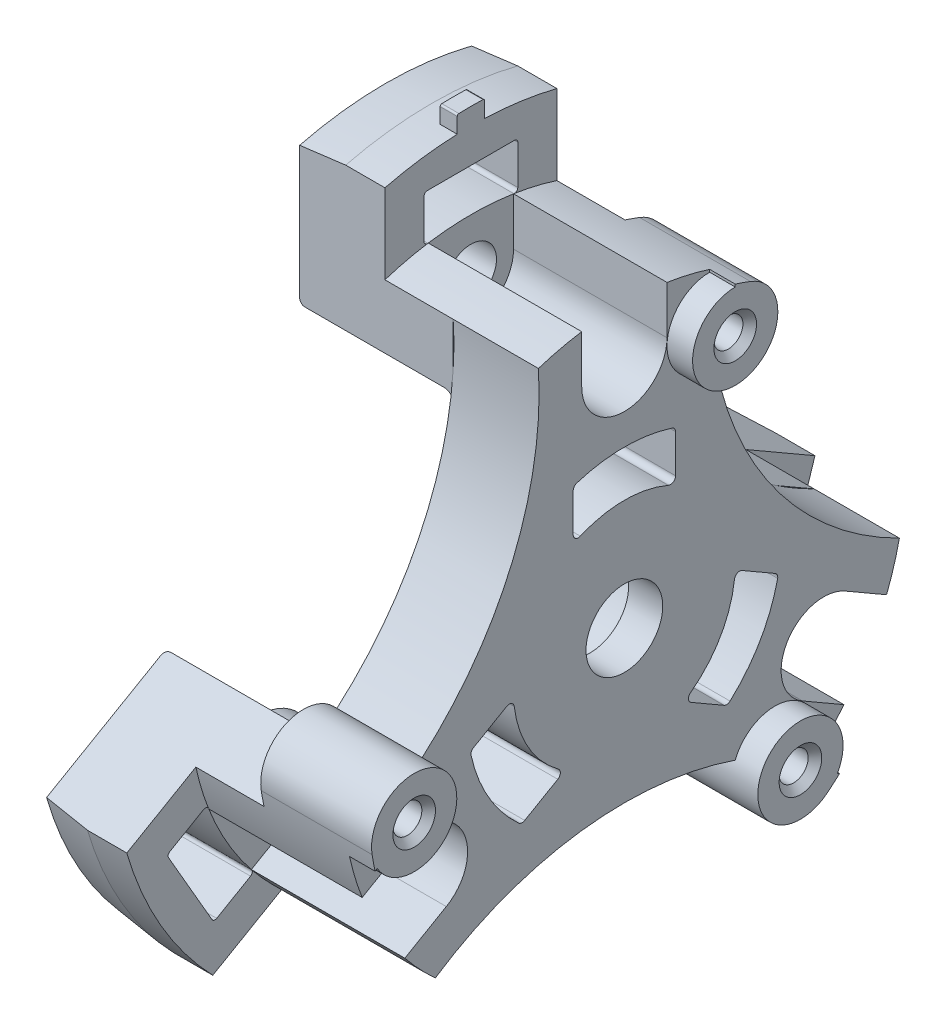
from build123d import *
from build123d.topology import SkipClean

# Parameters (mm, degrees)
SKETCH_2_R                           = 20
CUT_EXTRUDE_1_DEPTH                  = 10
PATTERN_CIRCULAR_1_COUNT             = 3
CUT_EXTRUDE_START                    = -10
CUT_EXTRUDE_2_DEPTH                  = 10
PATTERN_CIRCULAR_2_COUNT             = 3
SKETCH_4_R                           = 1.5
EXTRUDE_1_DEPTH                      = 9
PATTERN_CIRCULAR_3_COUNT             = 3
CUT_EXTRUDE_START_2                  = -1.7
CUT_EXTRUDE_3_DEPTH                  = 1.7
CUT_EXTRUDE_START_3                  = -2.5
CUT_EXTRUDE_8_DEPTH                  = 2.5
PATTERN_CIRCULAR_4_COUNT             = 3
CUT_EXTRUDE_4_DEPTH                  = 9
PATTERN_CIRCULAR_5_COUNT             = 3
EXTRUDE_START                        = -6.5
EXTRUDE_2_DEPTH                      = 6.5
SKETCH_9_R                           = 0.85
CUT_EXTRUDE_7_DEPTH                  = 6.4
CHAMFER_3_SIZE                       = 0.4
PATTERN_CIRCULAR_8_COUNT             = 3
CHAMFER_3_OF_PATTERN_CIRCULAR_8_SIZE = 0.4
CHAMFER_4_SIZE                       = 0.35
CHAMFER_4_SIZE2                      = 0.606217783
FILLET_6_R                           = 0.5
FILLET_7_R                           = 0.5
EXTRUDE_START_2                      = -5
EXTRUDE_3_DEPTH                      = 5
PATTERN_CIRCULAR_9_COUNT             = 3
EXTRUDE_4_DEPTH                      = 1
FILLET_9_R                           = 0.3
FILLET_10_R                          = 0.2
FILLET_11_R                          = 0.2


with BuildPart() as part:
    # 草图1 → 旋转1 (revolve)
    with BuildSketch(Plane.XY, mode=Mode.PRIVATE) as revolve_1_sk:
        Polygon((-7, 6.5), (-5, 6.5), (-5, 16.5), (0, 16.5), (0, 2.25), (-2, 2.25), (-2, 4), (-7, 4), align=None)
    revolve(revolve_1_sk.sketch.rotate(Axis((-65.742857143, 0, 0), (1, 0, 0)), 90), axis=Axis((-65.742857143, 0, 0), (1, 0, 0)))

    # 草图2 → 切除-拉伸1 (cut)
    with BuildSketch(Plane.ZY.offset(5)):
        with Locations((-25, 14.43375673)):
            Circle(SKETCH_2_R)
    cut_extrude_1 = extrude(amount=-CUT_EXTRUDE_1_DEPTH, mode=Mode.SUBTRACT)

    # 阵列(圆周)1: 切除-拉伸1 ×3 about axis
    pattern_circular_1_axis = Axis((0, 0, 0), (1, 0, 0))
    for i in range(1, PATTERN_CIRCULAR_1_COUNT):
        add(cut_extrude_1.rotate(pattern_circular_1_axis, i * 360 / PATTERN_CIRCULAR_1_COUNT), mode=Mode.SUBTRACT)

    # 草图3 → 切除-拉伸2 (cut)
    with BuildSketch(Plane.ZY.offset(5).offset(CUT_EXTRUDE_START)):
        with BuildLine():
            Line((-3, 8.480566019), (-3, 6.240993511))
            ThreePointArc((-3, 6.240993511), (-2.864719012, 5.990259295), (-2.580882353, 5.965655562))
            ThreePointArc((-2.580882353, 5.965655562), (0, 6.5), (2.580882353, 5.965655562))
            ThreePointArc((2.580882353, 5.965655562), (2.864719012, 5.990259295), (3, 6.240993511))
            Line((3, 6.240993511), (3, 8.480566019))
            ThreePointArc((3, 8.480566019), (2.9421811, 8.657620571), (2.791011236, 8.766427795))
            ThreePointArc((2.791011236, 8.766427795), (0, 9.2), (-2.791011236, 8.766427795))
            ThreePointArc((-2.791011236, 8.766427795), (-2.9421811, 8.657620571), (-3, 8.480566019))
        make_face()
    cut_extrude_2 = extrude(amount=CUT_EXTRUDE_2_DEPTH, mode=Mode.SUBTRACT)

    # 阵列(圆周)2: 切除-拉伸2 ×3 about axis
    pattern_circular_2_axis = Axis((0, 0, 0), (1, 0, 0))
    for i in range(1, PATTERN_CIRCULAR_2_COUNT):
        add(cut_extrude_2.rotate(pattern_circular_2_axis, i * 360 / PATTERN_CIRCULAR_2_COUNT), mode=Mode.SUBTRACT)

    # 草图4 → 凸台-拉伸1 (add)
    with BuildSketch(Plane.ZY.offset(5)):
        with BuildLine():
            Line((-5.040834524, 15.711142139), (-5.040834524, 11.98290396))
            ThreePointArc((-5.040834524, 11.98290396), (-4.096768005, 12.337604788), (-3.128046355, 12.618055556))
            ThreePointArc((-3.128046355, 12.618055556), (0, 10.25), (3.128046355, 12.618055556))
            ThreePointArc((3.128046355, 12.618055556), (4.096768005, 12.337604788), (5.040834524, 11.98290396))
            Line((5.040834524, 11.98290396), (5.040834524, 15.711142139))
            ThreePointArc((5.040834524, 15.711142139), (0, 16.5), (-5.040834524, 15.711142139))
        make_face()
        with Locations((0, 13.5)):
            Circle(SKETCH_4_R, mode=Mode.SUBTRACT)
    extrude_1 = extrude(amount=EXTRUDE_1_DEPTH)

    # 阵列(圆周)3: 凸台-拉伸1 ×3 about axis
    pattern_circular_3_axis = Axis((0, 0, 0), (1, 0, 0))
    for i in range(1, PATTERN_CIRCULAR_3_COUNT):
        add(extrude_1.rotate(pattern_circular_3_axis, i * 360 / PATTERN_CIRCULAR_3_COUNT))

    # 草图5 → 切除-拉伸3 (cut)
    with BuildSketch(Plane.ZY.offset(14).offset(CUT_EXTRUDE_START_2)):
        with BuildLine():
            Line((-3.25, 12.587195875), (-3.25, 9.290818443))
            Line((-3.25, 9.290818443), (3.25, 9.290818443))
            Line((3.25, 9.290818443), (3.25, 12.587195875))
            ThreePointArc((3.25, 12.587195875), (0, 13), (-3.25, 12.587195875))
        make_face()
    cut_extrude_3 = extrude(amount=CUT_EXTRUDE_3_DEPTH, mode=Mode.SUBTRACT)

    # 草图16 → 切除-拉伸8 (cut)
    with BuildSketch(Plane.ZY.offset(12.3).offset(CUT_EXTRUDE_START_3)):
        with BuildLine():
            ThreePointArc((-2.590612577, 12.739259259), (0, 10.8), (2.590612577, 12.739259259))
            ThreePointArc((2.590612577, 12.739259259), (2.859971605, 12.681504738), (3.128046355, 12.618055556))
            ThreePointArc((3.128046355, 12.618055556), (0, 10.25), (-3.128046355, 12.618055556))
            ThreePointArc((-3.128046355, 12.618055556), (-2.859971605, 12.681504738), (-2.590612577, 12.739259259))
        make_face()
    cut_extrude_8 = extrude(amount=CUT_EXTRUDE_8_DEPTH, mode=Mode.SUBTRACT)

    # 阵列(圆周)4: 切除-拉伸3, 切除-拉伸8 ×3 about axis
    pattern_circular_4_axis = Axis((0, 0, 0), (1, 0, 0))
    add([cut_extrude_3.rotate(pattern_circular_4_axis, i * 360 / PATTERN_CIRCULAR_4_COUNT) for i in range(1, PATTERN_CIRCULAR_4_COUNT)], mode=Mode.SUBTRACT)
    add([cut_extrude_8.rotate(pattern_circular_4_axis, i * 360 / PATTERN_CIRCULAR_4_COUNT) for i in range(1, PATTERN_CIRCULAR_4_COUNT)], mode=Mode.SUBTRACT)

    # 草图6 → 切除-拉伸4 (cut)
    with BuildSketch(Plane(origin=(0, 0, 0), x_dir=(0, 0, -1), z_dir=(1, 0, 0))):
        with BuildLine():
            Line((-2.5, 16.30950643), (-2.5, 13.5))
            ThreePointArc((-2.5, 13.5), (0, 11), (2.5, 13.5))
            Line((2.5, 13.5), (2.5, 16.30950643))
            ThreePointArc((2.5, 16.30950643), (0, 16.5), (-2.5, 16.30950643))
        make_face()
    cut_extrude_4 = extrude(amount=-CUT_EXTRUDE_4_DEPTH, mode=Mode.SUBTRACT)

    # 阵列(圆周)5: 切除-拉伸4 ×3 about axis
    pattern_circular_5_axis = Axis((0, 0, 0), (1, 0, 0))
    for i in range(1, PATTERN_CIRCULAR_5_COUNT):
        add(cut_extrude_4.rotate(pattern_circular_5_axis, i * 360 / PATTERN_CIRCULAR_5_COUNT), mode=Mode.SUBTRACT)

    # 草图7 → 凸台-拉伸2 (add)
    with BuildSketch(Plane.ZY.offset(5).offset(EXTRUDE_START)):
        with BuildLine():
            Line((-5, 15.576696831), (-5, 15.724185194))
            ThreePointArc((-5, 15.724185194), (-5.448667451, 15.574402814), (-5.892857143, 15.411821265))
            ThreePointArc((-5.892857143, 15.411821265), (-4.546023726, 10.618261242), (-5, 15.576696831))
        make_face()
    extrude_2 = extrude(amount=EXTRUDE_2_DEPTH)

    # 草图9 → 切除-拉伸7 (cut)
    with SkipClean():  # the faces are left unmerged after this step: merging them gives an invalid solid
        with BuildSketch(Plane(origin=(1.5, 0, 0), x_dir=(0, 0, -1), z_dir=(1, 0, 0))):
            with Locations((5, 13.076696831)):
                Circle(SKETCH_9_R)
        cut_extrude_7 = extrude(amount=-CUT_EXTRUDE_7_DEPTH, mode=Mode.SUBTRACT)

    # 倒角3
    chamfer_3_edges = [part.edges().sort_by_distance(p)[0] for p in [
        (1.5, 13.076696831, -4.15),
    ]]
    chamfer(chamfer_3_edges, length=CHAMFER_3_SIZE)

    # 阵列(圆周)8: 凸台-拉伸2, 切除-拉伸7 ×3 about axis
    with SkipClean():  # the faces are left unmerged after this step: merging them gives an invalid solid
        pattern_circular_8_axis = Axis((0, 0, 0), (1, 0, 0))
        add([extrude_2.rotate(pattern_circular_8_axis, i * 360 / PATTERN_CIRCULAR_8_COUNT) for i in range(1, PATTERN_CIRCULAR_8_COUNT)])
        add([cut_extrude_7.rotate(pattern_circular_8_axis, i * 360 / PATTERN_CIRCULAR_8_COUNT) for i in range(1, PATTERN_CIRCULAR_8_COUNT)], mode=Mode.SUBTRACT)

    # 倒角3 of 阵列(圆周)8
    chamfer_3_of_pattern_circular_8_edges = [part.edges().sort_by_distance(p)[0] for p in [
        (1.5, -2.94434299, 13.399751653),
        (1.5, -10.132353841, -9.249751653),
    ]]
    chamfer(chamfer_3_of_pattern_circular_8_edges, length=CHAMFER_3_OF_PATTERN_CIRCULAR_8_SIZE)

    # 倒角4
    chamfer_4_edges = [part.edges().sort_by_distance(p)[0] for p in [
        (-7, 0, -4),
    ]]
    chamfer_4_side = [part.faces().sort_by_distance(p)[0] for p in [
        (-7, 0, -4.183847763),
    ]]
    chamfer(chamfer_4_edges, length=CHAMFER_4_SIZE, length2=CHAMFER_4_SIZE2, reference=chamfer_4_side[0])

    # 圆角6
    # the kernel refuses this fillet: 0.5 mm, written as the material it adds along each edge
    with BuildSketch(Plane(origin=(-5, 0, 0), x_dir=(0, 0.8802769898101046, -0.47446013658774416), z_dir=(0, -0.47446013658774416, -0.8802769898101046))) as fillet_6_piece_1_section:
        with BuildLine():
            CenterArc((13 - FILLET_6_R, -FILLET_6_R), FILLET_6_R, 0, 90)
            Line((13, -FILLET_6_R), (13, 0))
            Line((13, 0), (13 - FILLET_6_R, 0))
        make_face()
    fillet_6_piece_1 = revolve(axis=Axis((-5, 0, 0), (1, 0, 0)), revolution_arc=19.910362379, mode=Mode.PRIVATE)
    fillet_6_piece_1 = split(fillet_6_piece_1, bisect_by=Plane(origin=(-5.110824058, 12.210811613, -5.040834524), z_dir=(0, 0, 1)), keep=Keep.TOP, mode=Mode.PRIVATE)
    fillet_6_piece_1 = fillet_6_piece_1 - Plane(origin=(-5.110824058, 13.5, 0), x_dir=(0, 0, 1), z_dir=(1, 0, 0)) * Cylinder(2.5, 52, mode=Mode.PRIVATE)
    add(fillet_6_piece_1)
    with BuildSketch(Plane(origin=(-5, 13.5, 0), x_dir=(0, 0.10999964007655953, 0.9939316270161782), z_dir=(0, 0.9939316270161782, -0.10999964007655953))) as fillet_6_piece_2:
        with BuildLine():
            CenterArc((3.25 + FILLET_6_R, -FILLET_6_R), FILLET_6_R, 90, 90)
            Line((3.25, -FILLET_6_R), (3.25, 0))
            Line((3.25, 0), (3.25 + FILLET_6_R, 0))
        make_face()
    revolve(axis=Axis((-5, 13.5, 0), (1, 0, 0)), revolution_arc=192.630589643)
    with BuildSketch(Plane(origin=(-5, 0, 0), x_dir=(0, 0.9892370095213199, 0.14632203864529783), z_dir=(0, 0.14632203864529783, -0.9892370095213199))) as fillet_6_piece_3_section:
        with BuildLine():
            CenterArc((13 - FILLET_6_R, -FILLET_6_R), FILLET_6_R, 0, 90)
            Line((13, -FILLET_6_R), (13, 0))
            Line((13, 0), (13 - FILLET_6_R, 0))
        make_face()
    fillet_6_piece_3 = revolve(axis=Axis((-5, 0, 0), (1, 0, 0)), revolution_arc=19.910362379, mode=Mode.PRIVATE)
    fillet_6_piece_3 = split(fillet_6_piece_3, bisect_by=Plane(origin=(-5.110824602, 12.21081128, 5.040834524), z_dir=(0, 0, -1)), keep=Keep.TOP, mode=Mode.PRIVATE)
    fillet_6_piece_3 = fillet_6_piece_3 - Plane(origin=(-5.110824602, 13.5, 0), x_dir=(0, 0, 1), z_dir=(1, 0, 0)) * Cylinder(2.5, 52, mode=Mode.PRIVATE)
    add(fillet_6_piece_3)
    with BuildSketch(Plane(origin=(-5, 0, 0), x_dir=(0, -0.8510330262730736, -0.5251121672485737), z_dir=(0, -0.5251121672485737, 0.8510330262730736))) as fillet_6_piece_4_section:
        with BuildLine():
            CenterArc((13 - FILLET_6_R, -FILLET_6_R), FILLET_6_R, 0, 90)
            Line((13, -FILLET_6_R), (13, 0))
            Line((13, 0), (13 - FILLET_6_R, 0))
        make_face()
    fillet_6_piece_4 = revolve(axis=Axis((-5, 0, 0), (1, 0, 0)), revolution_arc=19.910362379, mode=Mode.PRIVATE)
    fillet_6_piece_4 = split(fillet_6_piece_4, bisect_by=Plane(origin=(-5.110824058, -10.47089656, -8.054455796), z_dir=(0, 0.8660254037844384, -0.5000000000000004)), keep=Keep.TOP, mode=Mode.PRIVATE)
    fillet_6_piece_4 = fillet_6_piece_4 - Plane(origin=(-5.110824058, -6.75, -11.691342951), x_dir=(0, 0.8660254037844384, -0.5000000000000004), z_dir=(1, 0, 0)) * Cylinder(2.5, 52, mode=Mode.PRIVATE)
    add(fillet_6_piece_4)
    with BuildSketch(Plane(origin=(-5, -6.75, -11.691342951), x_dir=(0, 0.8057702185825306, -0.5922282962215338), z_dir=(0, -0.5922282962215338, -0.8057702185825306))) as fillet_6_piece_5:
        with BuildLine():
            CenterArc((3.25 + FILLET_6_R, -FILLET_6_R), FILLET_6_R, 90, 90)
            Line((3.25, -FILLET_6_R), (3.25, 0))
            Line((3.25, 0), (3.25 + FILLET_6_R, 0))
        make_face()
    revolve(axis=Axis((-5, -6.75, -11.691342951), (1, 0, 0)), revolution_arc=192.630589643)
    with BuildSketch(Plane(origin=(-5, 0, 0), x_dir=(0, -0.36789990216030416, -0.9298653999318603), z_dir=(0, -0.9298653999318603, 0.36789990216030416))) as fillet_6_piece_6_section:
        with BuildLine():
            CenterArc((13 - FILLET_6_R, -FILLET_6_R), FILLET_6_R, 0, 90)
            Line((13, -FILLET_6_R), (13, 0))
            Line((13, 0), (13 - FILLET_6_R, 0))
        make_face()
    fillet_6_piece_6 = revolve(axis=Axis((-5, 0, 0), (1, 0, 0)), revolution_arc=19.910362379, mode=Mode.PRIVATE)
    fillet_6_piece_6 = split(fillet_6_piece_6, bisect_by=Plane(origin=(-5.110824602, -1.739914886, -13.095290031), z_dir=(0, -0.8660254037844384, 0.5000000000000004)), keep=Keep.TOP, mode=Mode.PRIVATE)
    fillet_6_piece_6 = fillet_6_piece_6 - Plane(origin=(-5.110824602, -6.75, -11.691342951), x_dir=(0, 0.8660254037844384, -0.5000000000000004), z_dir=(1, 0, 0)) * Cylinder(2.5, 52, mode=Mode.PRIVATE)
    add(fillet_6_piece_6)
    with BuildSketch(Plane(origin=(-5, 0, 0), x_dir=(0, -0.029243963537030883, 0.9995723038363181), z_dir=(0, 0.9995723038363181, 0.029243963537030883))) as fillet_6_piece_7_section:
        with BuildLine():
            CenterArc((13 - FILLET_6_R, -FILLET_6_R), FILLET_6_R, 0, 90)
            Line((13, -FILLET_6_R), (13, 0))
            Line((13, 0), (13 - FILLET_6_R, 0))
        make_face()
    fillet_6_piece_7 = revolve(axis=Axis((-5, 0, 0), (1, 0, 0)), revolution_arc=19.910362379, mode=Mode.PRIVATE)
    fillet_6_piece_7 = split(fillet_6_piece_7, bisect_by=Plane(origin=(-5.110824058, -1.739915053, 13.095290319), z_dir=(0, -0.8660254037844388, -0.49999999999999983)), keep=Keep.TOP, mode=Mode.PRIVATE)
    fillet_6_piece_7 = fillet_6_piece_7 - Plane(origin=(-5.110824058, -6.75, 11.691342951), x_dir=(0, -0.8660254037844388, -0.49999999999999983), z_dir=(1, 0, 0)) * Cylinder(2.5, 52, mode=Mode.PRIVATE)
    add(fillet_6_piece_7)
    with BuildSketch(Plane(origin=(-5, -6.75, 11.691342951), x_dir=(0, -0.9157698586590889, -0.4017033307946455), z_dir=(0, -0.4017033307946455, 0.9157698586590889))) as fillet_6_piece_8:
        with BuildLine():
            CenterArc((3.25 + FILLET_6_R, -FILLET_6_R), FILLET_6_R, 90, 90)
            Line((3.25, -FILLET_6_R), (3.25, 0))
            Line((3.25, 0), (3.25 + FILLET_6_R, 0))
        make_face()
    revolve(axis=Axis((-5, -6.75, 11.691342951), (1, 0, 0)), revolution_arc=192.630589643)
    with BuildSketch(Plane(origin=(-5, 0, 0), x_dir=(0, -0.6213371073610158, 0.783543361286563), z_dir=(0, 0.783543361286563, 0.6213371073610158))) as fillet_6_piece_9_section:
        with BuildLine():
            CenterArc((13 - FILLET_6_R, -FILLET_6_R), FILLET_6_R, 0, 90)
            Line((13, -FILLET_6_R), (13, 0))
            Line((13, 0), (13 - FILLET_6_R, 0))
        make_face()
    fillet_6_piece_9 = revolve(axis=Axis((-5, 0, 0), (1, 0, 0)), revolution_arc=19.910362379, mode=Mode.PRIVATE)
    fillet_6_piece_9 = split(fillet_6_piece_9, bisect_by=Plane(origin=(-5.110824602, -10.470896394, 8.054455508), z_dir=(0, 0.8660254037844388, 0.49999999999999983)), keep=Keep.TOP, mode=Mode.PRIVATE)
    fillet_6_piece_9 = fillet_6_piece_9 - Plane(origin=(-5.110824602, -6.75, 11.691342951), x_dir=(0, -0.8660254037844388, -0.49999999999999983), z_dir=(1, 0, 0)) * Cylinder(2.5, 52, mode=Mode.PRIVATE)
    add(fillet_6_piece_9)

    # 圆角7
    fillet_7_edges = [part.edges().sort_by_distance(p)[0] for p in [
        (-7, 0, -6.5),
    ]]
    fillet(fillet_7_edges, radius=FILLET_7_R)

    # 草图11 → 凸台-拉伸3 (add)
    with BuildSketch(Plane.ZY.offset(14).offset(EXTRUDE_START_2)):
        with BuildLine():
            Line((-5.040834524, 15.711142139), (-5.040834524, 20.386024313))
            ThreePointArc((-5.040834524, 20.386024313), (-2.539044054, 20.845940979), (0, 21))
            ThreePointArc((0, 21), (2.539044054, 20.845940979), (5.040834524, 20.386024313))
            Line((5.040834524, 20.386024313), (5.040834524, 15.711142139))
            ThreePointArc((5.040834524, 15.711142139), (3.905398597, 16.031152853), (2.75, 16.269219404))
            Line((2.75, 16.269219404), (2.75, 18.8))
            ThreePointArc((2.75, 18.8), (2.691421356, 18.941421356), (2.55, 19))
            Line((2.55, 19), (-2.55, 19))
            ThreePointArc((-2.55, 19), (-2.691421356, 18.941421356), (-2.75, 18.8))
            Line((-2.75, 18.8), (-2.75, 16.269219404))
            ThreePointArc((-2.75, 16.269219404), (-3.905398597, 16.031152853), (-5.040834524, 15.711142139))
        make_face()
    extrude_3 = extrude(amount=EXTRUDE_3_DEPTH)

    # 阵列(圆周)9: 凸台-拉伸3 ×3 about axis
    pattern_circular_9_axis = Axis((0, 0, 0), (1, 0, 0))
    for i in range(1, PATTERN_CIRCULAR_9_COUNT):
        add(extrude_3.rotate(pattern_circular_9_axis, i * 360 / PATTERN_CIRCULAR_9_COUNT))

    # 草图12 → 凸台-拉伸4 (add)
    with BuildSketch(Plane(origin=(-9, 0, 0), x_dir=(0, 0, -1), z_dir=(1, 0, 0))):
        with BuildLine():
            Line((-0.8, 21.888809927), (-0.8, 20.984756372))
            ThreePointArc((-0.8, 20.984756372), (0, 21), (0.8, 20.984756372))
            Line((0.8, 20.984756372), (0.8, 21.888809927))
            ThreePointArc((0.8, 21.888809927), (0.771831869, 21.958381348), (0.703196347, 21.98875883))
            ThreePointArc((0.703196347, 21.98875883), (0, 22), (-0.703196347, 21.98875883))
            ThreePointArc((-0.703196347, 21.98875883), (-0.771831869, 21.958381348), (-0.8, 21.888809927))
        make_face()
    extrude(amount=-EXTRUDE_4_DEPTH)

    # 圆角9
    fillet_9_edges = [part.edges().sort_by_distance(p)[0] for p in [
        (-14, 12.587782675, -3.247726485),
        (-14, 12.587782675, 3.247726485),
        (-14, -9.106504978, -9.277476331),
        (-14, -3.481277697, -12.525202817),
        (-14, -3.481277697, 12.525202817),
        (-14, -9.106504978, 9.277476331),
    ]]
    fillet(fillet_9_edges, radius=FILLET_9_R)

    # 圆角10
    fillet_10_edges = [part.edges().sort_by_distance(p)[0] for p in [
        (-11.5, 16.269219404, -2.75),
        (-11.5, 16.269219404, 2.75),
        (-11.5, -10.516179562, -12.714557303),
        (-11.5, -5.753039841, -15.464557303),
        (-11.5, -5.753039841, 15.464557303),
        (-11.5, -10.516179562, 12.714557303),
    ]]
    fillet(fillet_10_edges, radius=FILLET_10_R)

    # 草图15 → 切除-旋转2 (revolve, cut)
    with BuildSketch(Plane.XY, mode=Mode.PRIVATE) as cut_revolve_2_sk:
        Polygon((-16.107755243, 21), (-11.3, 21), (-16.107755243, 20.409681884), align=None)
    revolve(cut_revolve_2_sk.sketch.rotate(Axis((8.388965583, 0, 0), (-1, 0, 0)), 263.394439623), axis=Axis((8.388965583, 0, 0), (-1, 0, 0)), mode=Mode.SUBTRACT)

    # 圆角11
    fillet_11_edges = [part.edges().sort_by_distance(p)[0] for p in [
        (-9.8, 10.8, 0),
        (-9.8, -5.4, 9.353074361),
        (-9.8, -5.4, -9.353074361),
    ]]
    fillet(fillet_11_edges, radius=FILLET_11_R)


solid = part.part
